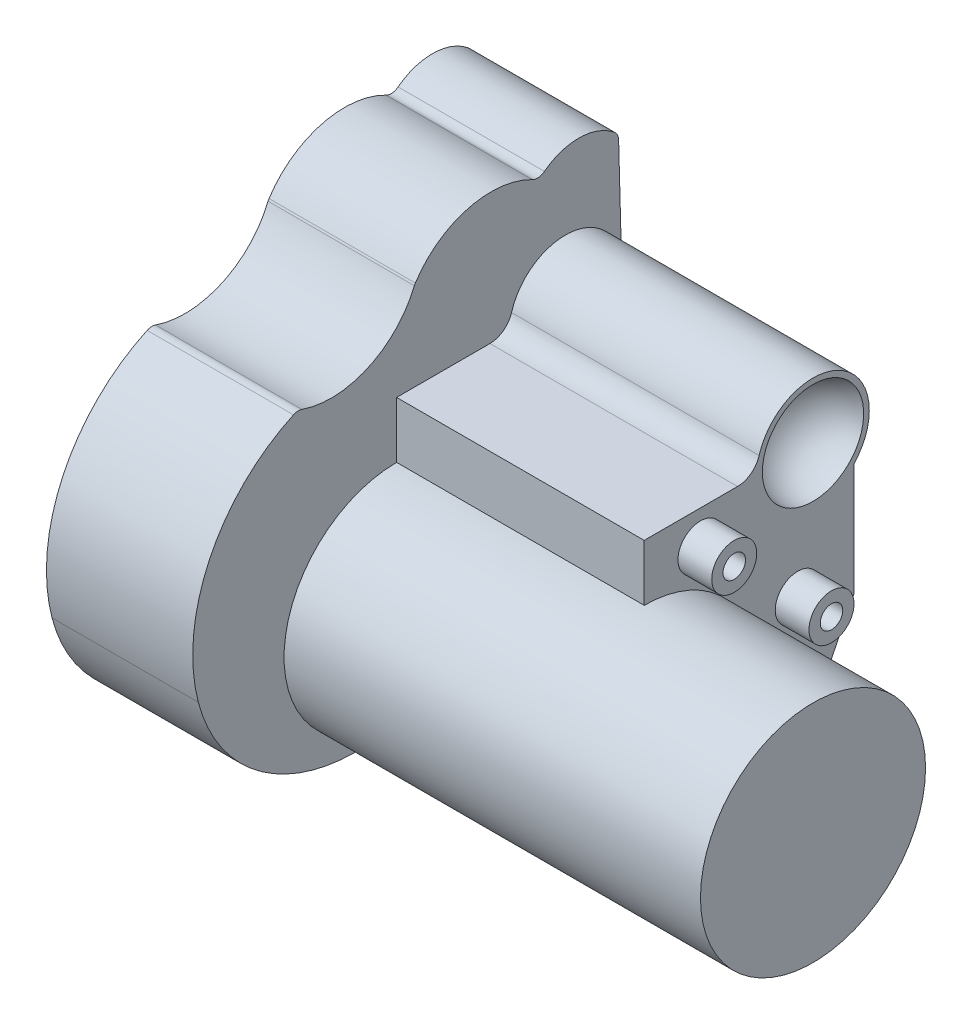
from build123d import *

# Parameters (mm, degrees)
SKETCH1_R           = 10
BOSS_EXTRUDE1_DEPTH = 50
BOSS_EXTRUDE3_DEPTH = 35
SKETCH8_R           = 2
SKETCH8_R_2         = 1
BOSS_EXTRUDE4_DEPTH = 3
BOSS_EXTRUDE6_DEPTH = 13
FILLET1_R           = 1
FILLET2_R           = 1
VARFILLET1_R        = 2


with BuildPart() as part:
    # Sketch1 → Boss-Extrude1 (new body)
    with BuildSketch(Plane(origin=(0, 0, 0), x_dir=(0, 0, -1), z_dir=(1, 0, 0))):
        Circle(SKETCH1_R)
    extrude(amount=-BOSS_EXTRUDE1_DEPTH)

    # Sketch3 → Boss-Extrude3 (add)
    with BuildSketch(Plane(origin=(-50, 0, 0), x_dir=(0, 0, -1), z_dir=(1, 0, 0))):
        with BuildLine():
            Line((0, 10), (0, 15))
            Line((0, 15), (10, 15))
            ThreePointArc((10, 15), (16.842071907, 19.648308412), (18.642708436, 11.574992664))
            Line((18.642708436, 11.574992664), (18.642708436, 1.574992664))
            Line((18.642708436, 1.574992664), (16.642708436, -2.425007336))
            Line((16.642708436, -2.425007336), (16.642708436, -9.997750449))
            ThreePointArc((16.642708436, -9.997750449), (13.321760405, -11.198307119), (10, -10))
            Line((10, -10), (0, -10))
            Line((0, -10), (0, 10))
        make_face()
    extrude(amount=BOSS_EXTRUDE3_DEPTH)

    # Sketch6 → Cut-Revolve1 (revolve, cut)
    with BuildSketch(Plane(origin=(-15, 0, 0), x_dir=(0, 0, -1), z_dir=(1, 0, 0))):
        with BuildLine():
            Line((13.321760405, -1.448307119), (13.321760405, -10.948307119))
            ThreePointArc((13.321760405, -10.948307119), (18.071760405, -6.198307119), (13.321760405, -1.448307119))
        make_face()
    revolve(axis=Axis((-15, -1.448307119, -13.321760405), (0, -1, 0)), mode=Mode.SUBTRACT)

    # Sketch7 → Cut-Revolve2 (revolve, cut)
    with BuildSketch(Plane(origin=(-15, 0, 0), x_dir=(0, 0, -1), z_dir=(1, 0, 0))):
        with BuildLine():
            Line((15, 10.5), (15, 19.5))
            ThreePointArc((15, 19.5), (19.5, 15), (15, 10.5))
        make_face()
    revolve(axis=Axis((-15, 10.5, -15), (0, 1, 0)), mode=Mode.SUBTRACT)

    # Sketch8 → Boss-Extrude4 (add)
    # profile 1 of 2: a face of its own
    with BuildSketch(Plane(origin=(-15, 0, 0), x_dir=(0, 0, -1), z_dir=(1, 0, 0))):
        with Locations((13.642708436, 3.801692881)):
            Circle(SKETCH8_R)
        with Locations((13.642708436, 3.801692881)):
            Circle(SKETCH8_R_2, mode=Mode.SUBTRACT)
    # profile 2 of 2: a face of its own
    with BuildSketch(Plane(origin=(-15, 0, 0), x_dir=(0, 0, -1), z_dir=(1, 0, 0))):
        with Locations((5, 12)):
            Circle(SKETCH8_R)
        with Locations((5, 12)):
            Circle(SKETCH8_R_2, mode=Mode.SUBTRACT)
    extrude(amount=BOSS_EXTRUDE4_DEPTH)

    # Sketch10 → Boss-Extrude6 (add)
    with BuildSketch(Plane.ZY.offset(50)):
        with BuildLine():
            Line((-19.714603594, 25.400073987), (-19.992475161, 15.274211174))
            ThreePointArc((-19.992475161, 15.274211174), (-14.862842799, 19.998118436), (-10, 15))
            Line((-10, 15), (0, 15))
            Line((0, 15), (0, 10))
            ThreePointArc((0, 10), (10, 0), (0, -10))
            ThreePointArc((0, -10), (10.951955319, -8.476456548), (17.618849286, 0.345053233))
            ThreePointArc((17.618849286, 0.345053233), (16.545732573, 11.017476726), (8.77988791, 18.416386062))
            ThreePointArc((8.77988791, 18.416386062), (2.657537615, 18.500996178), (-1.611789409, 22.889979975))
            ThreePointArc((-1.611789409, 22.889979975), (-6.607805104, 26.429776463), (-12.643535782, 25.400073987))
            ThreePointArc((-12.643535782, 25.400073987), (-16.179069688, 26.864540081), (-19.714603594, 25.400073987))
        make_face()
    extrude(amount=-BOSS_EXTRUDE6_DEPTH)

    # Fillet1
    fillet1_edges = [part.edges().sort_by_distance(p)[0] for p in [
        (-43.5, 18.416386062, 8.77988791),
        (-43.5, 22.889979975, -1.611789409),
        (-43.5, 25.400073987, -12.643535782),
    ]]
    fillet(fillet1_edges, radius=FILLET1_R)

    # Fillet2
    fillet2_edges = [part.edges().sort_by_distance(p)[0] for p in [
        (-43.5, 25.400073987, -19.714603594),
    ]]
    fillet(fillet2_edges, radius=FILLET2_R)

    # Sketch11 → Cut-Revolve3 (revolve, cut)
    with BuildSketch(Plane(origin=(0, 0.559709606, -20.396267082), x_dir=(-1, 0, 0), z_dir=(0, 0.02743144017102401, -0.999623687239425))):
        with BuildLine():
            Line((50, 24.072659381), (50, 15.072659381))
            ThreePointArc((50, 15.072659381), (45.5, 19.572659381), (50, 24.072659381))
        make_face()
    revolve(axis=Axis((-50, 24.623310138, -19.735919367), (0, -0.9996236872394249, -0.027431440171024075)), mode=Mode.SUBTRACT)

    # VarFillet1
    varfillet1_edges = [part.edges().sort_by_distance(p)[0] for p in [
        (-26, 15, -10),
    ]]
    fillet(varfillet1_edges, radius=VARFILLET1_R)


solid = part.part
